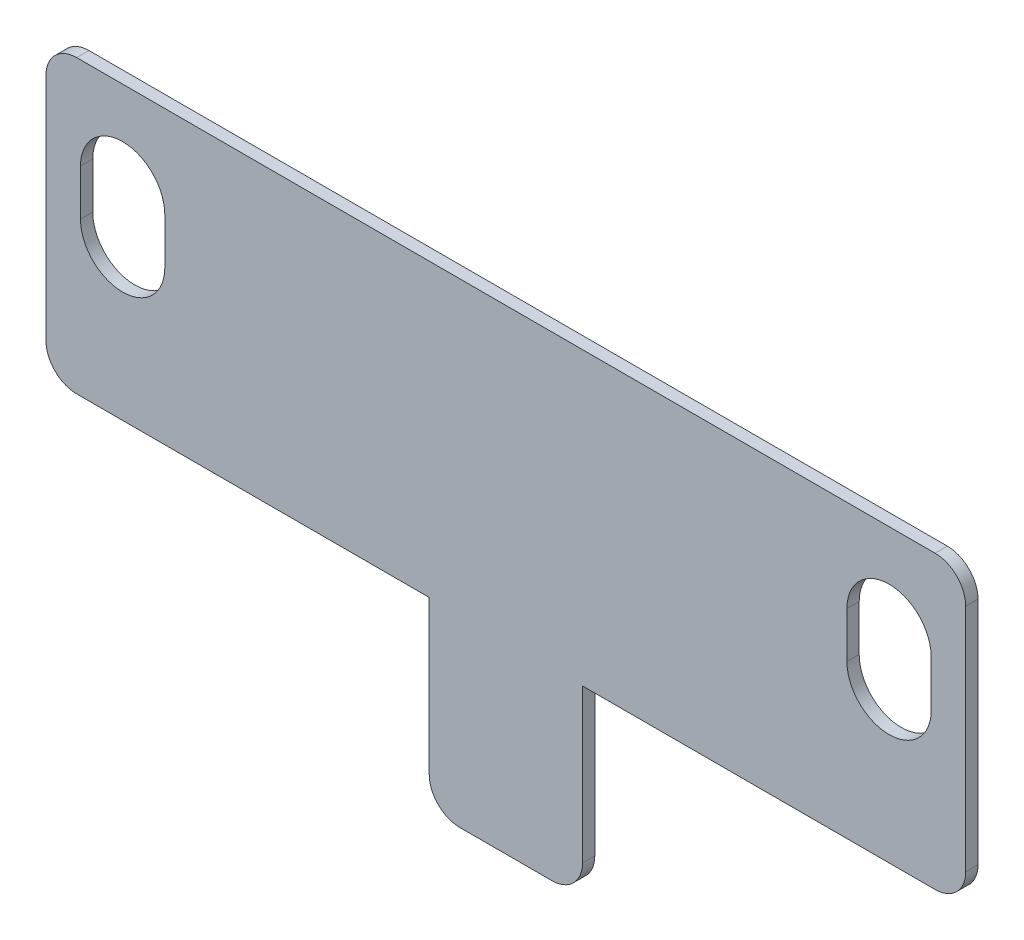
from build123d import *

# Parameters (mm, degrees)
SKETCH_1_W             = 60
SKETCH_1_H             = 31
SM_BASE_FLANGE_1_DEPTH = 0.8
CUT_EXTRUDE_2_DEPTH    = 44.146726411
SKETCH_14_W            = 25
SKETCH_14_H            = 12
CUT_EXTRUDE_3_DEPTH    = 44.146726411
FILLET_3_R             = 2


# Sheet-metal steps are written as plain solids
with BuildPart() as part:
    # Sketch 1 → 基体-法兰1 (new body)
    with BuildSketch(Plane.XY):
        with Locations((0, -15.5)):
            Rectangle(SKETCH_1_W, SKETCH_1_H)
    extrude(amount=SM_BASE_FLANGE_1_DEPTH)

    # 草图13 → 切除-拉伸2 (cut, through all)
    with BuildSketch(Plane.XY.offset(0.8)):
        with BuildLine():
            Line((-27.75, -9), (-27.75, -6))
            ThreePointArc((-27.75, -6), (-25, -3.25), (-22.25, -6))
            Line((-22.25, -6), (-22.25, -9))
            ThreePointArc((-22.25, -9), (-25, -11.75), (-27.75, -9))
        make_face()
        with BuildLine():
            Line((27.75, -9), (27.75, -6))
            ThreePointArc((27.75, -6), (25, -3.25), (22.25, -6))
            Line((22.25, -6), (22.25, -9))
            ThreePointArc((22.25, -9), (25, -11.75), (27.75, -9))
        make_face()
    extrude(amount=-CUT_EXTRUDE_2_DEPTH, mode=Mode.SUBTRACT)

    # 草图14 → 切除-拉伸3 (cut, through all)
    with BuildSketch(Plane.XY.offset(0.8)):
        with Locations((-17.5, -25)):
            Rectangle(SKETCH_14_W, SKETCH_14_H)
        with Locations((17.5, -25)):
            Rectangle(SKETCH_14_W, SKETCH_14_H)
    extrude(amount=-CUT_EXTRUDE_3_DEPTH, mode=Mode.SUBTRACT)

    # 圆角3
    fillet_3_edges = [part.edges().sort_by_distance(p)[0] for p in [
        (-5, -31, 0.4),
        (-30, -19, 0.4),
        (5, -31, 0.4),
        (30, -19, 0.4),
        (-30, 0, 0.4),
        (30, 0, 0.4),
    ]]
    fillet(fillet_3_edges, radius=FILLET_3_R)


solid = part.part
